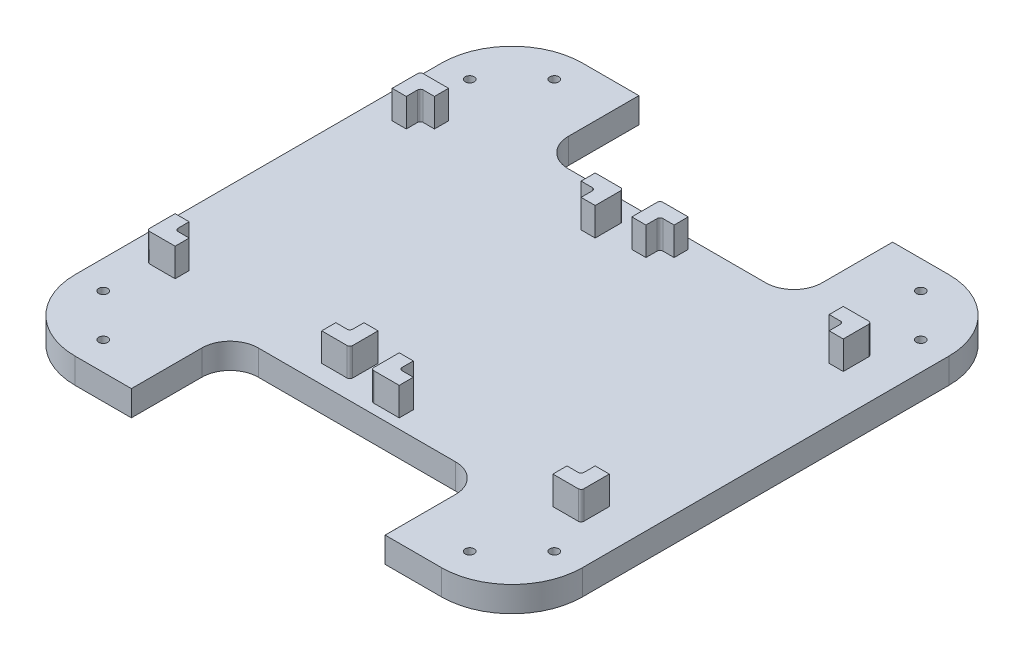
from build123d import *

# Parameters (mm, degrees)
PLATE_DEPTH               = 9
SKETCH3_R                 = 1.6
HEX_HOLES_DEPTH           = 128.597021909
RASPBERRY_PI_HOLDER_DEPTH = 10
FILLET1_R                 = 1
SKETCH5_W                 = 90
SKETCH5_H                 = 35
CUT_EXTRUDE1_DEPTH        = 128.671453348
FILLET2_R                 = 10


with BuildPart() as part:
    # Sketch1 → Plate (new body)
    with BuildSketch(Plane(origin=(0, 0, 0), x_dir=(1, 0, 0), z_dir=(0, 1, 0))):
        with BuildLine():
            Line((-65, -90), (65, -90))
            ThreePointArc((65, -90), (82.67766953, -82.67766953), (90, -65))
            Line((90, -65), (90, 65))
            ThreePointArc((90, 65), (82.67766953, 82.67766953), (65, 90))
            Line((65, 90), (-65, 90))
            ThreePointArc((-65, 90), (-82.67766953, 82.67766953), (-90, 65))
            Line((-90, 65), (-90, -65))
            ThreePointArc((-90, -65), (-82.67766953, -82.67766953), (-65, -90))
        make_face()
    extrude(amount=PLATE_DEPTH)

    # Sketch3 → Hex Holes (cut, through all)
    with BuildSketch(Plane(origin=(0, 9, 0), x_dir=(1, 0, 0), z_dir=(0, 1, 0))):
        with Locations((-65, 80)):
            Circle(SKETCH3_R)
        with Locations((-80, 65)):
            Circle(SKETCH3_R)
        with Locations((80, 65)):
            Circle(SKETCH3_R)
        with Locations((80, -65)):
            Circle(SKETCH3_R)
        with Locations((65, 80)):
            Circle(SKETCH3_R)
        with Locations((65, -80)):
            Circle(SKETCH3_R)
        with Locations((-65, -80)):
            Circle(SKETCH3_R)
        with Locations((-80, -65)):
            Circle(SKETCH3_R)
    extrude(amount=-HEX_HOLES_DEPTH, mode=Mode.SUBTRACT)

    # Sketch4 → Raspberry Pi Holder (add)
    with BuildSketch(Plane(origin=(0, 9, 0), x_dir=(1, 0, 0), z_dir=(0, 1, 0))):
        Polygon((6, 41.5), (6, 46.5), (11, 46.5), (11, 51.5), (1, 51.5), (1, 41.5), align=None)
        Polygon((66, 51.5), (76, 51.5), (76, 41.5), (71, 41.5), (71, 46.5), (66, 46.5), align=None)
        Polygon((1.5, -41.5), (1.5, -51.5), (11.5, -51.5), (11.5, -46.5), (6.5, -46.5), (6.5, -41.5), align=None)
        Polygon((66, -46.5), (66, -51.5), (76, -51.5), (76, -41.5), (71, -41.5), (71, -46.5), align=None)
        Polygon((-76, 43.5), (-71, 43.5), (-71, 48.5), (-81, 48.5), (-81, 38.5), (-76, 38.5), align=None)
        Polygon((-19, 43.5), (-19, 48.5), (-9, 48.5), (-9, 38.5), (-14, 38.5), (-14, 43.5), align=None)
        Polygon((-76, -38.5), (-76, -43.5), (-71, -43.5), (-71, -48.5), (-81, -48.5), (-81, -38.5), align=None)
        Polygon((-19, -43.5), (-14, -43.5), (-14, -38.5), (-9, -38.5), (-9, -48.5), (-19, -48.5), align=None)
    extrude(amount=RASPBERRY_PI_HOLDER_DEPTH)

    # Fillet1
    fillet1_edges = [part.edges().sort_by_distance(p)[0] for p in [
        (1, 14, -51.5),
        (6, 14, -46.5),
        (6.5, 14, 46.5),
        (1.5, 14, 51.5),
        (71, 14, 46.5),
        (76, 14, 51.5),
        (76, 14, -51.5),
        (71, 14, -46.5),
        (-14, 14, 43.5),
        (-76, 14, 43.5),
        (-9, 14, 48.5),
        (-81, 14, 48.5),
        (-76, 14, -43.5),
        (-81, 14, -48.5),
        (-14, 14, -43.5),
        (-9, 14, -48.5),
    ]]
    fillet(fillet1_edges, radius=FILLET1_R)

    # Sketch5 → Cut-Extrude1 (cut, through all)
    with BuildSketch(Plane(origin=(0, 9, 0), x_dir=(1, 0, 0), z_dir=(0, 1, 0))):
        with Locations((0, 72.5)):
            Rectangle(SKETCH5_W, SKETCH5_H)
        with Locations((0, -72.5)):
            Rectangle(SKETCH5_W, SKETCH5_H)
    extrude(amount=-CUT_EXTRUDE1_DEPTH, mode=Mode.SUBTRACT)

    # Fillet2
    fillet2_edges = [part.edges().sort_by_distance(p)[0] for p in [
        (45, 4.5, -55),
        (-45, 4.5, -55),
        (45, 4.5, 55),
        (-45, 4.5, 55),
    ]]
    fillet(fillet2_edges, radius=FILLET2_R)


solid = part.part
